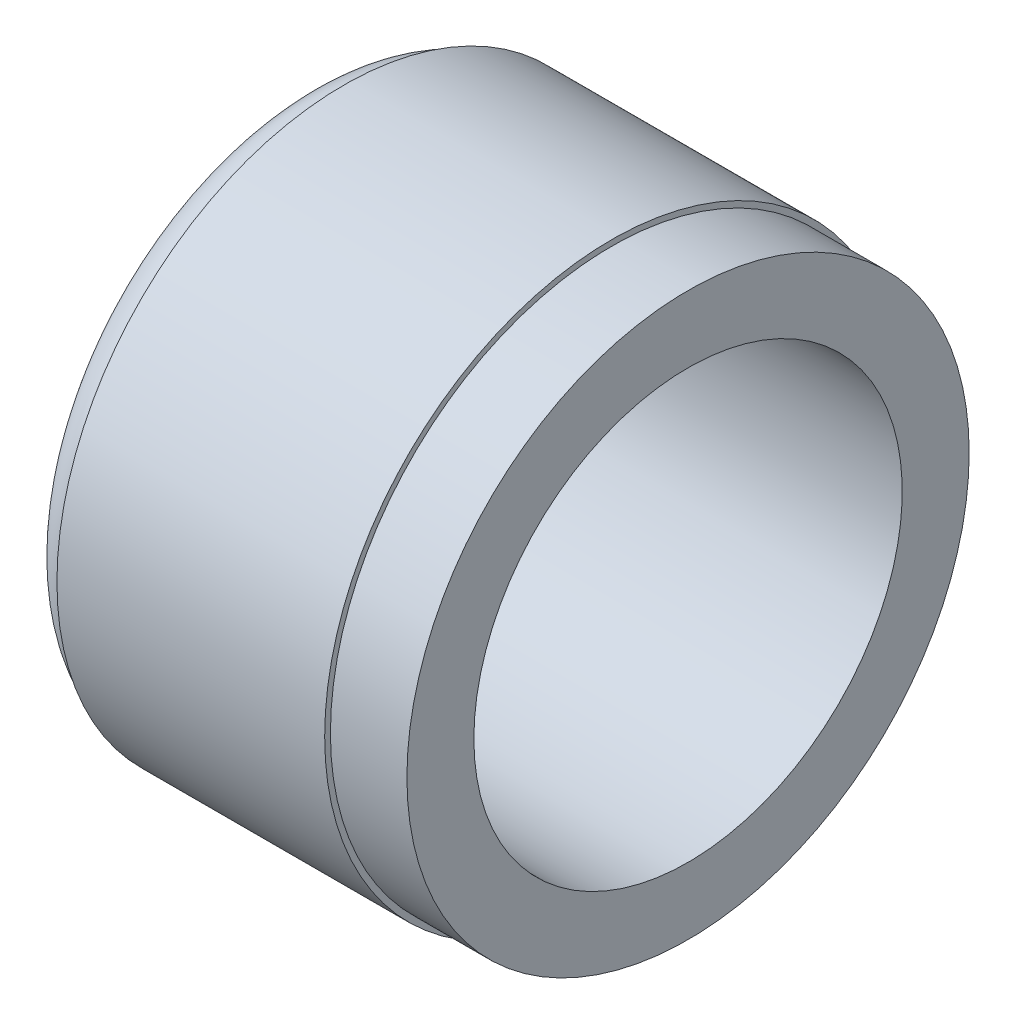
from build123d import *

# Parameters (mm, degrees)
FILLET_1_R = 2


with BuildPart() as part:
    # Эскиз1 → Повернуть1 (revolve)
    with BuildSketch(Plane.XY, mode=Mode.PRIVATE) as revolve_1_sk:
        Polygon((0, 11.2), (20, 11.2), (20, 14.7), (16, 14.7), (16, 15), (2, 15), (2, 14.7), (0, 14.7), align=None)
    revolve(revolve_1_sk.sketch.rotate(Axis((0, 0, 0), (1, 0, 0)), 90), axis=Axis((0, 0, 0), (1, 0, 0)))

    # Скругление1
    fillet_1_edges = [part.edges().sort_by_distance(p)[0] for p in [
        (0, 0, -14.7),
    ]]
    fillet(fillet_1_edges, radius=FILLET_1_R - 0.0001)  # a hair under: the kernel refuses the full size


solid = part.part
